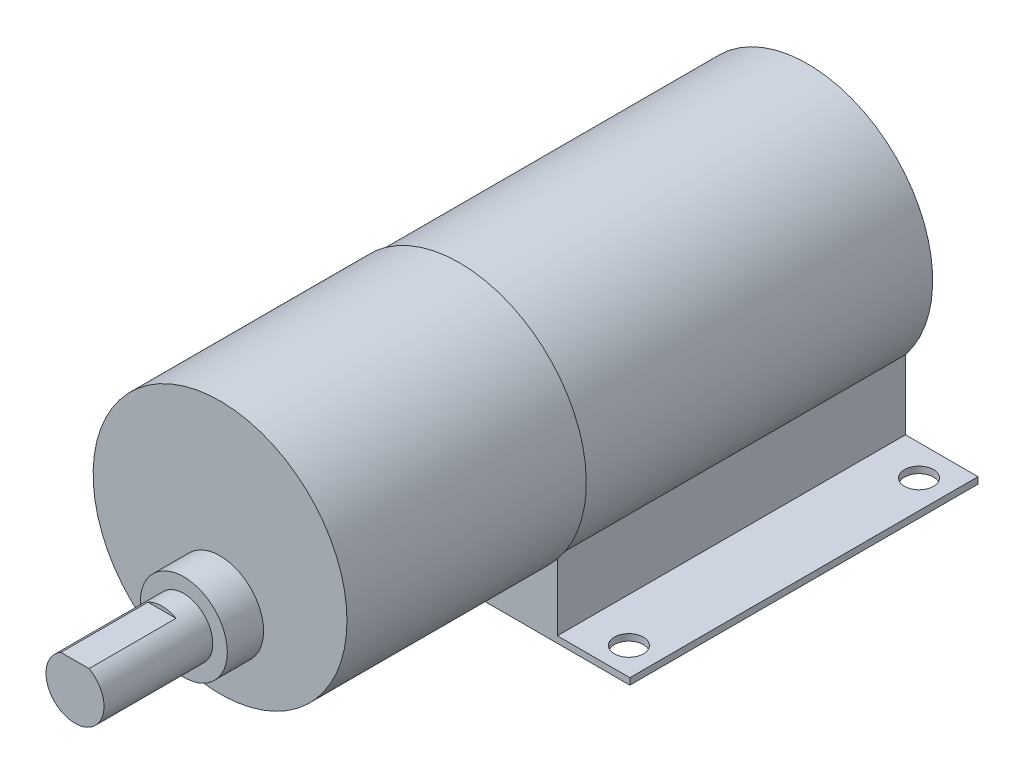
from build123d import *

# Parameters (mm, degrees)
EXTRUSION1_DEPTH    = 48
ESQUISSE2_R         = 2
EXTRUSION2_DEPTH    = 3
ESQUISSE3_R         = 17.5
EXTRUSION3_DEPTH    = 33
ESQUISSE4_R         = 6
EXTRUSION4_DEPTH    = 20
ESQUISSE5_OUTSIDE_W = 72.586
ESQUISSE5_OUTSIDE_H = 64.286
ESQUISSE5_OUTSIDE_R = 4
EXTRUSION6_DEPTH    = 15
ESQUISSE6_W         = 12.800429143
ESQUISSE6_H         = 4.483478886
EXTRUSION7_DEPTH    = 12
EXTRUSION8_START    = -21.2
EXTRUSION8_DEPTH    = 0.1


# Read off the part's stored shape, not the designer's step: Extrusion8
with BuildPart() as part:
    # Esquisse1 → Extrusion1 (new body)
    with BuildSketch(Plane.XY):
        with BuildLine():
            Line((-13.5, -10.738365797), (-13.5, -20.3))
            Line((-13.5, -20.3), (-23.5, -20.3))
            Line((-23.5, -20.3), (-23.5, -21.2))
            Line((-23.5, -21.2), (23.5, -21.2))
            Line((23.5, -21.2), (23.5, -20.3))
            Line((23.5, -20.3), (13.5, -20.3))
            Line((13.5, -20.3), (13.5, -10.738365797))
            ThreePointArc((13.5, -10.738365797), (0, 17.25), (-13.5, -10.738365797))
        make_face()
    extrude(amount=EXTRUSION1_DEPTH)

    # Esquisse2 → Extrusion2 (cut)
    with BuildSketch(Plane.XZ.offset(21.2)):
        with Locations((-19.411381194, 44.219649199)):
            Circle(ESQUISSE2_R)
        with Locations((19.588618806, 44.219649199)):
            Circle(ESQUISSE2_R)
        with Locations((19.588618806, 4.219649199)):
            Circle(ESQUISSE2_R)
        with Locations((-19.411381194, 4.219649199)):
            Circle(ESQUISSE2_R)
    extrude(amount=-EXTRUSION2_DEPTH, mode=Mode.SUBTRACT)

    # Esquisse3 → Extrusion3 (add)
    with BuildSketch(Plane.XY.offset(48)):
        with Locations(Location((0, 0, 0), (0, 0, 219.517652797))):
            Circle(ESQUISSE3_R)
    extrude(amount=EXTRUSION3_DEPTH)

    # Esquisse4 → Extrusion4 (add)
    with BuildSketch(Plane.XY.offset(81)):
        with Locations((0, -7)):
            Circle(ESQUISSE4_R)
    extrude(amount=EXTRUSION4_DEPTH)

    # Esquisse5 outside → Extrusion6 (cut)
    with BuildSketch(Plane.XY.offset(101)):
        with Locations((0, -1.85)):
            Rectangle(ESQUISSE5_OUTSIDE_W, ESQUISSE5_OUTSIDE_H)
        with Locations((0, -7)):
            Circle(ESQUISSE5_OUTSIDE_R, mode=Mode.SUBTRACT)
    extrude(amount=-EXTRUSION6_DEPTH, mode=Mode.SUBTRACT)

    # Esquisse6 → Extrusion7 (cut)
    with BuildSketch(Plane.XY.offset(101)):
        with Locations((-0.09625683, -1.258260557)):
            Rectangle(ESQUISSE6_W, ESQUISSE6_H)
    extrude(amount=-EXTRUSION7_DEPTH, mode=Mode.SUBTRACT)

    # Extrusion8 outline → Extrusion8 (cut)
    # profile 1 of 13: a face of its own
    with BuildSketch(Plane(origin=(0, 0, 0), x_dir=(1, 0, 0), z_dir=(0, 1, 0)).offset(EXTRUSION8_START)):
        with BuildLine():
            add(Edge.make_bspline(
                [(-13.374256386, -24.092045366), (-13.373133076, -24.134861912), (-13.370909114, -24.219631314), (-13.354588605, -24.344558375), (-13.327230049, -24.465255764), (-13.288498652, -24.58118124), (-13.238983461, -24.692936676), (-13.178622173, -24.800341507), (-13.106831541, -24.903329308), (-13.051629589, -24.967051388), (-13.023695488, -24.999296969)],
                knots=[0, 0, 0, 0, 0.128919132, 0.255237725, 0.378678596, 0.501087887, 0.622713679, 0.746240795, 0.871589047, 1, 1, 1, 1], degree=3))
            add(Edge.make_bspline(
                [(-13.023695488, -24.999296969), (-12.991246897, -25.033271908), (-12.927431034, -25.100089604), (-12.820082306, -25.185622128), (-12.707588485, -25.259538202), (-12.587863559, -25.319014417), (-12.462180701, -25.365852935), (-12.329961458, -25.39841845), (-12.191685943, -25.419671805), (-12.097126322, -25.421729983), (-12.049136194, -25.422774533)],
                knots=[0, 0, 0, 0, 0.128497521, 0.252712986, 0.374819133, 0.496436426, 0.617910557, 0.741287617, 0.868700401, 1, 1, 1, 1], degree=3))
            add(Edge.make_bspline(
                [(-12.049136194, -25.422774533), (-12.001144921, -25.421752642), (-11.907045763, -25.419748963), (-11.769237877, -25.398333997), (-11.637692741, -25.365586633), (-11.511906549, -25.320315071), (-11.393490254, -25.25963312), (-11.28071901, -25.187223829), (-11.173902001, -25.101441235), (-11.109878971, -25.035083167), (-11.077381386, -25.001400334)],
                knots=[0, 0, 0, 0, 0.131751427, 0.258332351, 0.382133976, 0.503804392, 0.624692987, 0.74687059, 0.871513504, 1, 1, 1, 1], degree=3))
            add(Edge.make_bspline(
                [(-11.077381386, -25.001400334), (-11.049399432, -24.969186348), (-10.993977052, -24.905381806), (-10.922911333, -24.801926193), (-10.861689773, -24.694786092), (-10.812626812, -24.582538766), (-10.773941788, -24.466164095), (-10.746476092, -24.345262083), (-10.730139157, -24.220099736), (-10.72793619, -24.135095898), (-10.726820488, -24.092045366)],
                knots=[0, 0, 0, 0, 0.12815728, 0.253834363, 0.376505623, 0.498533686, 0.621367729, 0.744564745, 0.870633798, 1, 1, 1, 1], degree=3))
            add(Edge.make_bspline(
                [(-10.726820488, -24.092045366), (-10.727801826, -24.048745308), (-10.729740994, -23.963182375), (-10.74808461, -23.837163009), (-10.776615696, -23.714968187), (-10.817447535, -23.597109493), (-10.869805644, -23.483226665), (-10.933696331, -23.373817116), (-11.009567948, -23.268664983), (-11.095571945, -23.168663145), (-11.190623821, -23.07649693), (-11.29373997, -22.99616866), (-11.402894003, -22.927347136), (-11.519537357, -22.87191072), (-11.642604844, -22.82820102), (-11.772361912, -22.797501003), (-11.908606982, -22.77893932), (-12.001634203, -22.776555746), (-12.049136194, -22.775338635)],
                knots=[0, 0, 0, 0, 0.062416026, 0.123336979, 0.18326514, 0.243172443, 0.302898354, 0.363773598, 0.425605305, 0.489659043, 0.553784577, 0.616221533, 0.677854471, 0.739516897, 0.802096536, 0.865865841, 0.931507795, 1, 1, 1, 1], degree=3))
            add(Edge.make_bspline(
                [(-12.049136194, -22.775338635), (-12.096870913, -22.776559831), (-12.190361773, -22.778951606), (-12.327087755, -22.797428889), (-12.457077374, -22.828186871), (-12.580305972, -22.872054364), (-12.697450819, -22.927348908), (-12.807237316, -22.995960597), (-12.910437232, -23.076520753), (-13.005509216, -23.16865669), (-13.091507821, -23.268666646), (-13.16738083, -23.373816684), (-13.231271156, -23.483226778), (-13.28362936, -23.597109463), (-13.324461173, -23.714968195), (-13.352992265, -23.837163007), (-13.37133588, -23.963182376), (-13.373275048, -24.048745309), (-13.374256386, -24.092045366)],
                knots=[0, 0, 0, 0, 0.068742262, 0.134635192, 0.198324187, 0.260825013, 0.322713588, 0.384554535, 0.446912858, 0.510957633, 0.574930701, 0.636684538, 0.697483115, 0.757133808, 0.816965664, 0.876818352, 0.93766258, 1, 1, 1, 1], degree=3))
        make_face()
        with BuildLine():
            add(Edge.make_bspline(
                [(-12.050538437, -23.089441199), (-12.005312068, -23.09075148), (-11.916036472, -23.093337936), (-11.785577295, -23.119056756), (-11.660663324, -23.159160417), (-11.542431936, -23.215082627), (-11.432865333, -23.286095042), (-11.333516211, -23.370531419), (-11.2477676, -23.46994527), (-11.174433995, -23.580502799), (-11.114887253, -23.699787151), (-11.071704051, -23.825577623), (-11.045706465, -23.956359665), (-11.042525636, -24.045187996), (-11.040923053, -24.089942001)],
                knots=[0, 0, 0, 0, 0.085605695, 0.168983264, 0.250907582, 0.333708096, 0.416004984, 0.497659568, 0.579893286, 0.663902321, 0.748466254, 0.831790886, 0.915251909, 1, 1, 1, 1], degree=3))
            add(Edge.make_bspline(
                [(-11.040923053, -24.089942001), (-11.041881323, -24.124579558), (-11.043767052, -24.192740984), (-11.058242016, -24.293003438), (-11.081397556, -24.389495034), (-11.113369173, -24.482347038), (-11.156023187, -24.570859542), (-11.20843998, -24.654889269), (-11.268671005, -24.736265815), (-11.338688126, -24.811619456), (-11.413991504, -24.881354492), (-11.494456542, -24.941983882), (-11.578241521, -24.993441477), (-11.665620104, -25.036127718), (-11.757072671, -25.068075058), (-11.8518798, -25.09145169), (-11.95007861, -25.105741886), (-12.016837653, -25.107689028), (-12.050538437, -25.108671969)],
                knots=[0, 0, 0, 0, 0.065184796, 0.128273727, 0.19027022, 0.251768314, 0.312768695, 0.374793279, 0.437969586, 0.5030474, 0.568125214, 0.630949749, 0.692369109, 0.752973168, 0.813641067, 0.874355209, 0.936572968, 1, 1, 1, 1], degree=3))
            add(Edge.make_bspline(
                [(-12.050538437, -25.108671969), (-12.084476049, -25.107707377), (-12.151475177, -25.105803094), (-12.250094762, -25.09131919), (-12.345034916, -25.068371686), (-12.43647576, -25.035767629), (-12.524108932, -24.99366873), (-12.608018335, -24.94196037), (-12.688450775, -24.881327414), (-12.763832838, -24.811864742), (-12.83301515, -24.735985748), (-12.893493127, -24.655137389), (-12.944918233, -24.570631042), (-12.987758392, -24.482378831), (-13.01966558, -24.389486417), (-13.042838603, -24.293005786), (-13.057308843, -24.19274037), (-13.059195222, -24.124579351), (-13.060153822, -24.089942001)],
                knots=[0, 0, 0, 0, 0.0638459, 0.126043628, 0.187165358, 0.24739929, 0.308380031, 0.369779617, 0.432583925, 0.497640786, 0.562401137, 0.625557103, 0.687332005, 0.748312746, 0.809791039, 0.871767572, 0.934836191, 1, 1, 1, 1], degree=3))
            add(Edge.make_bspline(
                [(-13.060153822, -24.089942001), (-13.058546998, -24.045189973), (-13.055357754, -23.956365568), (-13.029422517, -23.825554445), (-12.986036237, -23.699972593), (-12.927448958, -23.580356207), (-12.854042739, -23.469683929), (-12.767555672, -23.371012445), (-12.668915972, -23.285826633), (-12.559299472, -23.215145788), (-12.440945154, -23.158986032), (-12.315688833, -23.119187056), (-12.185048139, -23.093315364), (-12.095767408, -23.09074389), (-12.050538437, -23.089441199)],
                knots=[0, 0, 0, 0, 0.084732745, 0.168178654, 0.251488198, 0.335840671, 0.419834494, 0.502344876, 0.58364902, 0.665931005, 0.748716525, 0.831047336, 0.914409807, 1, 1, 1, 1], degree=3))
        make_face(mode=Mode.SUBTRACT)
    # profile 2 of 13: a face of its own
    with BuildSketch(Plane(origin=(0, 0, 0), x_dir=(1, 0, 0), z_dir=(0, 1, 0)).offset(EXTRUSION8_START)):
        with BuildLine():
            add(Edge.make_bspline(
                [(-8.572974335, -24.092045366), (-8.571851024, -24.134861912), (-8.569627063, -24.219631314), (-8.553306554, -24.344558375), (-8.525947997, -24.465255764), (-8.487216601, -24.58118124), (-8.43770141, -24.692936676), (-8.377340122, -24.800341507), (-8.305549489, -24.903329308), (-8.250347538, -24.967051388), (-8.222413437, -24.999296969)],
                knots=[0, 0, 0, 0, 0.128919132, 0.255237725, 0.378678596, 0.501087887, 0.622713679, 0.746240795, 0.871589047, 1, 1, 1, 1], degree=3))
            add(Edge.make_bspline(
                [(-8.222413437, -24.999296969), (-8.189964846, -25.033271908), (-8.126148982, -25.100089604), (-8.018800255, -25.185622128), (-7.906306433, -25.259538202), (-7.786581507, -25.319014417), (-7.660898649, -25.365852935), (-7.528679407, -25.39841845), (-7.390403891, -25.419671805), (-7.29584427, -25.421729983), (-7.247854142, -25.422774533)],
                knots=[0, 0, 0, 0, 0.128497521, 0.252712986, 0.374819133, 0.496436426, 0.617910557, 0.741287617, 0.868700401, 1, 1, 1, 1], degree=3))
            add(Edge.make_bspline(
                [(-7.247854142, -25.422774533), (-7.199862869, -25.421752642), (-7.105763712, -25.419748963), (-6.967955826, -25.398333997), (-6.83641069, -25.365586633), (-6.710624498, -25.320315071), (-6.592208202, -25.25963312), (-6.479436958, -25.187223829), (-6.372619949, -25.101441235), (-6.30859692, -25.035083167), (-6.276099335, -25.001400334)],
                knots=[0, 0, 0, 0, 0.131751427, 0.258332351, 0.382133976, 0.503804392, 0.624692987, 0.74687059, 0.871513504, 1, 1, 1, 1], degree=3))
            add(Edge.make_bspline(
                [(-6.276099335, -25.001400334), (-6.248117381, -24.969186348), (-6.192695, -24.905381806), (-6.121629282, -24.801926193), (-6.060407721, -24.694786092), (-6.01134476, -24.582538766), (-5.972659737, -24.466164095), (-5.94519404, -24.345262083), (-5.928857105, -24.220099736), (-5.926654139, -24.135095898), (-5.925538437, -24.092045366)],
                knots=[0, 0, 0, 0, 0.12815728, 0.253834363, 0.376505623, 0.498533686, 0.621367729, 0.744564745, 0.870633798, 1, 1, 1, 1], degree=3))
            add(Edge.make_bspline(
                [(-5.925538437, -24.092045366), (-5.926519774, -24.048745308), (-5.928458943, -23.963182375), (-5.946802559, -23.837163009), (-5.975333645, -23.714968187), (-6.016165483, -23.597109493), (-6.068523593, -23.483226665), (-6.13241428, -23.373817116), (-6.208285897, -23.268664983), (-6.294289894, -23.168663145), (-6.38934177, -23.07649693), (-6.492457918, -22.99616866), (-6.601611952, -22.927347136), (-6.718255305, -22.87191072), (-6.841322792, -22.82820102), (-6.97107986, -22.797501003), (-7.107324931, -22.77893932), (-7.200352152, -22.776555746), (-7.247854142, -22.775338635)],
                knots=[0, 0, 0, 0, 0.062416026, 0.123336979, 0.18326514, 0.243172443, 0.302898354, 0.363773598, 0.425605305, 0.489659043, 0.553784577, 0.616221533, 0.677854471, 0.739516897, 0.802096536, 0.865865841, 0.931507795, 1, 1, 1, 1], degree=3))
            add(Edge.make_bspline(
                [(-7.247854142, -22.775338635), (-7.295588862, -22.776559831), (-7.389079722, -22.778951606), (-7.525805703, -22.797428889), (-7.655795322, -22.828186871), (-7.779023921, -22.872054364), (-7.896168768, -22.927348908), (-8.005955265, -22.995960597), (-8.10915518, -23.076520753), (-8.204227165, -23.16865669), (-8.29022577, -23.268666646), (-8.366098778, -23.373816684), (-8.429989105, -23.483226778), (-8.482347308, -23.597109463), (-8.523179121, -23.714968195), (-8.551710214, -23.837163007), (-8.570053829, -23.963182376), (-8.571992997, -24.048745309), (-8.572974335, -24.092045366)],
                knots=[0, 0, 0, 0, 0.068742262, 0.134635192, 0.198324187, 0.260825013, 0.322713588, 0.384554535, 0.446912858, 0.510957633, 0.574930701, 0.636684538, 0.697483115, 0.757133808, 0.816965664, 0.876818352, 0.93766258, 1, 1, 1, 1], degree=3))
        make_face()
        with BuildLine():
            add(Edge.make_bspline(
                [(-7.249256386, -23.089441199), (-7.204030017, -23.09075148), (-7.114754421, -23.093337936), (-6.984295244, -23.119056756), (-6.859381272, -23.159160417), (-6.741149885, -23.215082627), (-6.631583281, -23.286095042), (-6.53223416, -23.370531419), (-6.446485549, -23.46994527), (-6.373151944, -23.580502799), (-6.313605201, -23.699787151), (-6.270421999, -23.825577623), (-6.244424414, -23.956359665), (-6.241243585, -24.045187996), (-6.239641001, -24.089942001)],
                knots=[0, 0, 0, 0, 0.085605695, 0.168983264, 0.250907582, 0.333708096, 0.416004984, 0.497659568, 0.579893286, 0.663902321, 0.748466254, 0.831790886, 0.915251909, 1, 1, 1, 1], degree=3))
            add(Edge.make_bspline(
                [(-6.239641001, -24.089942001), (-6.240599271, -24.124579558), (-6.242485, -24.192740984), (-6.256959965, -24.293003438), (-6.280115504, -24.389495034), (-6.312087122, -24.482347038), (-6.354741136, -24.570859542), (-6.407157929, -24.654889269), (-6.467388954, -24.736265815), (-6.537406075, -24.811619456), (-6.612709453, -24.881354492), (-6.693174491, -24.941983882), (-6.77695947, -24.993441477), (-6.864338052, -25.036127718), (-6.95579062, -25.068075058), (-7.050597749, -25.09145169), (-7.148796559, -25.105741886), (-7.215555602, -25.107689028), (-7.249256386, -25.108671969)],
                knots=[0, 0, 0, 0, 0.065184796, 0.128273727, 0.19027022, 0.251768314, 0.312768695, 0.374793279, 0.437969586, 0.5030474, 0.568125214, 0.630949749, 0.692369109, 0.752973168, 0.813641067, 0.874355209, 0.936572968, 1, 1, 1, 1], degree=3))
            add(Edge.make_bspline(
                [(-7.249256386, -25.108671969), (-7.283193997, -25.107707377), (-7.350193126, -25.105803094), (-7.448812711, -25.09131919), (-7.543752865, -25.068371686), (-7.635193709, -25.035767629), (-7.722826881, -24.99366873), (-7.806736283, -24.94196037), (-7.887168723, -24.881327414), (-7.962550787, -24.811864742), (-8.031733099, -24.735985748), (-8.092211076, -24.655137389), (-8.143636182, -24.570631042), (-8.186476341, -24.482378831), (-8.218383529, -24.389486417), (-8.241556551, -24.293005786), (-8.256026792, -24.19274037), (-8.25791317, -24.124579351), (-8.258871771, -24.089942001)],
                knots=[0, 0, 0, 0, 0.0638459, 0.126043628, 0.187165358, 0.24739929, 0.308380031, 0.369779617, 0.432583925, 0.497640786, 0.562401137, 0.625557103, 0.687332005, 0.748312746, 0.809791039, 0.871767572, 0.934836191, 1, 1, 1, 1], degree=3))
            add(Edge.make_bspline(
                [(-8.258871771, -24.089942001), (-8.257264947, -24.045189973), (-8.254075702, -23.956365568), (-8.228140466, -23.825554445), (-8.184754186, -23.699972593), (-8.126166906, -23.580356207), (-8.052760688, -23.469683929), (-7.966273621, -23.371012445), (-7.867633921, -23.285826633), (-7.75801742, -23.215145788), (-7.639663103, -23.158986032), (-7.514406781, -23.119187056), (-7.383766087, -23.093315364), (-7.294485356, -23.09074389), (-7.249256386, -23.089441199)],
                knots=[0, 0, 0, 0, 0.084732745, 0.168178654, 0.251488198, 0.335840671, 0.419834494, 0.502344876, 0.58364902, 0.665931005, 0.748716525, 0.831047336, 0.914409807, 1, 1, 1, 1], degree=3))
        make_face(mode=Mode.SUBTRACT)
    # profile 3 of 13: a face of its own
    with BuildSketch(Plane(origin=(0, 0, 0), x_dir=(1, 0, 0), z_dir=(0, 1, 0)).offset(EXTRUSION8_START)):
        with BuildLine():
            Line((-5.072974335, -25.377902738), (-5.072974335, -25.001400334))
            add(Edge.make_bspline(
                [(-5.072974335, -25.001400334), (-5.049785576, -25.036456162), (-5.005437255, -25.103500162), (-4.931724326, -25.192169463), (-4.856220994, -25.265584509), (-4.778565807, -25.324088028), (-4.698187707, -25.367901147), (-4.616850755, -25.399994182), (-4.533275286, -25.418971497), (-4.477113361, -25.421505156), (-4.448975937, -25.422774533)],
                knots=[0, 0, 0, 0, 0.160059412, 0.306112383, 0.438366514, 0.560541455, 0.675317225, 0.786113634, 0.892841788, 1, 1, 1, 1], degree=3))
            add(Edge.make_bspline(
                [(-4.448975937, -25.422774533), (-4.427149611, -25.421584006), (-4.382240525, -25.41913442), (-4.314257936, -25.401923596), (-4.244214484, -25.374445573), (-4.199072097, -25.34860535), (-4.175538437, -25.335134308)],
                knots=[0, 0, 0, 0, 0.225277548, 0.463523195, 0.720323555, 1, 1, 1, 1], degree=3))
            Line((-4.175538437, -25.335134308), (-4.348014399, -25.063099052))
            add(Edge.make_bspline(
                [(-4.348014399, -25.063099052), (-4.36312342, -25.069839318), (-4.391803234, -25.082633633), (-4.433757801, -25.097775644), (-4.472439137, -25.106691559), (-4.497082696, -25.108042277), (-4.50857129, -25.108671969)],
                knots=[0, 0, 0, 0, 0.295138801, 0.560229945, 0.794983357, 1, 1, 1, 1], degree=3))
            add(Edge.make_bspline(
                [(-4.50857129, -25.108671969), (-4.533777023, -25.106991931), (-4.585189413, -25.103565142), (-4.660673913, -25.076626334), (-4.733921118, -25.033101094), (-4.79209278, -24.984829982), (-4.837135033, -24.938282185), (-4.869275259, -24.897633782), (-4.898758006, -24.852055151), (-4.926928226, -24.802325467), (-4.95259452, -24.747595621), (-4.97654919, -24.688412407), (-4.998208053, -24.624707279), (-5.010558297, -24.580324758), (-5.016884591, -24.557590238)],
                knots=[0, 0, 0, 0, 0.093806529, 0.191338128, 0.295190617, 0.410312337, 0.471930251, 0.536425159, 0.603118728, 0.674117672, 0.749332023, 0.828283384, 0.912039809, 1, 1, 1, 1], degree=3))
            add(Edge.make_bspline(
                [(-5.016884591, -24.557590238), (-5.021616984, -24.537313064), (-5.032098876, -24.492400666), (-5.042290414, -24.417052141), (-5.052359932, -24.328028482), (-5.05945655, -24.225081889), (-5.066034592, -24.108469445), (-5.069744675, -23.9780135), (-5.072847815, -23.833580149), (-5.072930882, -23.732605795), (-5.072974335, -23.679785751)],
                knots=[0, 0, 0, 0, 0.070854869, 0.15693815, 0.258600395, 0.37589093, 0.508166168, 0.656237809, 0.82017677, 1, 1, 1, 1], degree=3))
            Line((-5.072974335, -23.679785751), (-5.072974335, -22.82021043))
            Line((-5.072974335, -22.82021043), (-5.387076899, -22.82021043))
            Line((-5.387076899, -22.82021043), (-5.387076899, -25.377902738))
            Line((-5.387076899, -25.377902738), (-5.072974335, -25.377902738))
        make_face()
    # profile 4 of 13: a face of its own
    with BuildSketch(Plane(origin=(0, 0, 0), x_dir=(1, 0, 0), z_dir=(0, 1, 0)).offset(EXTRUSION8_START)):
        with BuildLine():
            add(Edge.make_bspline(
                [(-3.637076899, -24.031748892), (-3.635537292, -23.998048427), (-3.632509718, -23.931777824), (-3.618394575, -23.834807041), (-3.596145801, -23.742433698), (-3.564876739, -23.655350656), (-3.527009894, -23.572420529), (-3.480624177, -23.494258492), (-3.425284623, -23.421220562), (-3.363558923, -23.352653424), (-3.294851828, -23.291592663), (-3.222569081, -23.236940887), (-3.145675516, -23.19113529), (-3.064777432, -23.1539554), (-2.980005647, -23.124849084), (-2.891333452, -23.104981264), (-2.798935336, -23.091674157), (-2.735949602, -23.090194492), (-2.70388379, -23.089441199)],
                knots=[0, 0, 0, 0, 0.068384615, 0.134475588, 0.198391058, 0.260753477, 0.321829223, 0.383037238, 0.444653123, 0.507398011, 0.569825238, 0.630777641, 0.690928687, 0.750945133, 0.811049477, 0.872330853, 0.935004094, 1, 1, 1, 1], degree=3))
            add(Edge.make_bspline(
                [(-2.70388379, -23.089441199), (-2.672532642, -23.090049256), (-2.610325951, -23.091255757), (-2.517685094, -23.102987668), (-2.426545566, -23.121957944), (-2.337284583, -23.147847934), (-2.251713737, -23.179424786), (-2.172468187, -23.217527643), (-2.099587972, -23.25967739), (-2.031471005, -23.307887065), (-1.965400012, -23.366895252), (-1.899857525, -23.440530973), (-1.829580872, -23.527618501), (-1.785591279, -23.593164167), (-1.762277219, -23.627902738)],
                knots=[0, 0, 0, 0, 0.082592263, 0.163878894, 0.24565874, 0.327725695, 0.408609961, 0.485749086, 0.559169056, 0.630268476, 0.705306028, 0.792064966, 0.889796437, 1, 1, 1, 1], degree=3))
            Line((-1.762277219, -23.627902738), (-1.483230745, -23.481368283))
            add(Edge.make_bspline(
                [(-1.483230745, -23.481368283), (-1.50546734, -23.441924951), (-1.548730949, -23.365183849), (-1.623131696, -23.259751988), (-1.701123769, -23.164904272), (-1.786227737, -23.083174618), (-1.875897416, -23.011923233), (-1.970630071, -22.949585408), (-2.070918889, -22.896466888), (-2.176768613, -22.85171436), (-2.289068164, -22.817304866), (-2.408089681, -22.793000645), (-2.534061176, -22.777977376), (-2.620407356, -22.776232236), (-2.664620969, -22.775338635)],
                knots=[0, 0, 0, 0, 0.093369857, 0.181660766, 0.265874227, 0.346354784, 0.424599862, 0.501903184, 0.579992091, 0.658443431, 0.738672236, 0.821894148, 0.908800792, 1, 1, 1, 1], degree=3))
            add(Edge.make_bspline(
                [(-2.664620969, -22.775338635), (-2.713762947, -22.776485811), (-2.809624708, -22.778723617), (-2.949164456, -22.798016082), (-3.080543874, -22.82948844), (-3.203755577, -22.873453982), (-3.31849783, -22.930881306), (-3.424998685, -23.000840788), (-3.523818211, -23.082973043), (-3.61184242, -23.177989486), (-3.691086302, -23.279671443), (-3.761012122, -23.385627328), (-3.819469553, -23.495590552), (-3.867022164, -23.608861076), (-3.905427029, -23.72472497), (-3.932193732, -23.844236437), (-3.94762348, -23.967072022), (-3.949987926, -24.050169357), (-3.951179463, -24.092045366)],
                knots=[0, 0, 0, 0, 0.071578658, 0.139629225, 0.204796697, 0.268134963, 0.329813747, 0.391301398, 0.453433515, 0.51655169, 0.579631271, 0.641118921, 0.701294047, 0.760810336, 0.819931722, 0.878919575, 0.938982822, 1, 1, 1, 1], degree=3))
            add(Edge.make_bspline(
                [(-3.951179463, -24.092045366), (-3.950120321, -24.131340196), (-3.948021243, -24.209217361), (-3.934790456, -24.324482906), (-3.911342163, -24.436511358), (-3.879165839, -24.545395806), (-3.837614593, -24.65095394), (-3.786782373, -24.753250004), (-3.726589996, -24.852175144), (-3.680117322, -24.914578277), (-3.656708309, -24.946011712)],
                knots=[0, 0, 0, 0, 0.128044808, 0.2537679, 0.377428427, 0.500550841, 0.623295883, 0.746578332, 0.872347541, 1, 1, 1, 1], degree=3))
            add(Edge.make_bspline(
                [(-3.656708309, -24.946011712), (-3.625000626, -24.983880582), (-3.56258968, -25.058418733), (-3.457033324, -25.156357058), (-3.342733128, -25.238400834), (-3.221121502, -25.30640797), (-3.090785028, -25.358081617), (-2.953475737, -25.396589199), (-2.80763015, -25.41816721), (-2.70792493, -25.421215044), (-2.656908629, -25.422774533)],
                knots=[0, 0, 0, 0, 0.128835254, 0.253589335, 0.374643257, 0.495340042, 0.616324775, 0.739759335, 0.86684232, 1, 1, 1, 1], degree=3))
            add(Edge.make_bspline(
                [(-2.656908629, -25.422774533), (-2.604461024, -25.421420484), (-2.501570778, -25.418764149), (-2.351538657, -25.394137815), (-2.209577941, -25.355085261), (-2.075745436, -25.29993147), (-1.950027576, -25.228771918), (-1.833241526, -25.140630077), (-1.723390013, -25.03821199), (-1.659481435, -24.95944878), (-1.626960713, -24.919369084)],
                knots=[0, 0, 0, 0, 0.132040234, 0.259032841, 0.381879824, 0.502258444, 0.62275219, 0.744742632, 0.870108927, 1, 1, 1, 1], degree=3))
            add(Edge.make_bspline(
                [(-1.626960713, -24.919369084), (-1.604833775, -24.889165503), (-1.560727181, -24.828959384), (-1.505480081, -24.730788227), (-1.457522686, -24.628077632), (-1.419189725, -24.519167335), (-1.388150224, -24.405347755), (-1.365693405, -24.28580521), (-1.352523787, -24.160575299), (-1.34993509, -24.075248744), (-1.34861536, -24.031748892)],
                knots=[0, 0, 0, 0, 0.11852184, 0.236254763, 0.356174434, 0.477249655, 0.601539871, 0.729618382, 0.862158266, 1, 1, 1, 1], degree=3))
            Line((-1.34861536, -24.031748892), (-3.637076899, -24.031748892))
        make_face()
        with BuildLine():
            add(Edge.make_bspline(
                [(-2.640782828, -25.108671969), (-2.672132267, -25.108060297), (-2.734103516, -25.106851151), (-2.825404584, -25.095381022), (-2.913084283, -25.076421177), (-2.99778957, -25.05045622), (-3.078410439, -25.015847618), (-3.156605207, -24.975264391), (-3.230385603, -24.925722807), (-3.276526899, -24.887963952), (-3.299837315, -24.868888315)],
                knots=[0, 0, 0, 0, 0.131091976, 0.259141276, 0.384161763, 0.505991952, 0.629098089, 0.750669123, 0.874038938, 1, 1, 1, 1], degree=3))
            add(Edge.make_bspline(
                [(-3.299837315, -24.868888315), (-3.316530597, -24.853793999), (-3.350313732, -24.823246783), (-3.395454253, -24.770617577), (-3.438674726, -24.713866014), (-3.478008379, -24.65082089), (-3.514085965, -24.582200111), (-3.547845942, -24.508582476), (-3.578232354, -24.429409345), (-3.595328464, -24.374236906), (-3.604124174, -24.345851456)],
                knots=[0, 0, 0, 0, 0.109983845, 0.222580497, 0.338499871, 0.458708565, 0.585535346, 0.717517743, 0.85466682, 1, 1, 1, 1], degree=3))
            Line((-3.604124174, -24.345851456), (-1.662717924, -24.345851456))
            add(Edge.make_bspline(
                [(-1.662717924, -24.345851456), (-1.674214549, -24.387514329), (-1.69634185, -24.46770195), (-1.742578215, -24.578742841), (-1.794649756, -24.677430742), (-1.856271487, -24.763010375), (-1.926090213, -24.839013888), (-2.006735395, -24.905432473), (-2.097171289, -24.964849924), (-2.196930429, -25.015002423), (-2.302572214, -25.057692282), (-2.413178406, -25.086317398), (-2.526036194, -25.10592694), (-2.602370481, -25.107753048), (-2.640782828, -25.108671969)],
                knots=[0, 0, 0, 0, 0.096240125, 0.185231261, 0.267500523, 0.344400382, 0.419594869, 0.496890627, 0.576637919, 0.660267852, 0.745386615, 0.830040327, 0.914474212, 1, 1, 1, 1], degree=3))
        make_face(mode=Mode.SUBTRACT)
    # profile 5 of 13: a face of its own
    with BuildSketch(Plane(origin=(0, 0, 0), x_dir=(1, 0, 0), z_dir=(0, 1, 0)).offset(EXTRUSION8_START)):
        with BuildLine():
            Line((1.568051306, -22.82021043), (1.568051306, -23.262618283))
            add(Edge.make_bspline(
                [(1.568051306, -23.262618283), (1.532632516, -23.222578689), (1.463512301, -23.144440918), (1.348071183, -23.042358745), (1.225703005, -22.957980424), (1.097001683, -22.889830508), (0.96208344, -22.838638452), (0.821247353, -22.802252292), (0.674435972, -22.778858457), (0.574183617, -22.776522435), (0.523379832, -22.775338635)],
                knots=[0, 0, 0, 0, 0.134298379, 0.262084975, 0.386269912, 0.507164597, 0.627300236, 0.748144942, 0.872370177, 1, 1, 1, 1], degree=3))
            add(Edge.make_bspline(
                [(0.523379832, -22.775338635), (0.478211878, -22.776565008), (0.389138673, -22.778983468), (0.258109596, -22.797745772), (0.132017347, -22.827876393), (0.010742774, -22.869777283), (-0.104929371, -22.925358104), (-0.215989468, -22.991899352), (-0.32186216, -23.071140182), (-0.420933699, -23.161728211), (-0.512165699, -23.260123198), (-0.592226972, -23.365068745), (-0.658980052, -23.476111049), (-0.714800133, -23.591844203), (-0.757796477, -23.713159122), (-0.787770111, -23.83963629), (-0.806510558, -23.971126164), (-0.808928019, -24.060665687), (-0.810153822, -24.106067802)],
                knots=[0, 0, 0, 0, 0.064619991, 0.127433484, 0.189004127, 0.249930071, 0.310668454, 0.372328961, 0.43493911, 0.499575544, 0.564191208, 0.626735217, 0.688109334, 0.749293607, 0.810330528, 0.87190117, 0.935045915, 1, 1, 1, 1], degree=3))
            add(Edge.make_bspline(
                [(-0.810153822, -24.106067802), (-0.80890085, -24.150531505), (-0.806423794, -24.238433849), (-0.787970574, -24.367712547), (-0.756939565, -24.492230808), (-0.713391717, -24.611587751), (-0.657549762, -24.725927801), (-0.589621675, -24.835331826), (-0.509602551, -24.940101223), (-0.417350144, -25.03777245), (-0.317415374, -25.127993064), (-0.210506643, -25.20640211), (-0.099283361, -25.274118959), (0.017979649, -25.327772435), (0.139546754, -25.37118154), (0.2665002, -25.401214508), (0.398311778, -25.418911829), (0.487802271, -25.421474593), (0.533195537, -25.422774533)],
                knots=[0, 0, 0, 0, 0.063774532, 0.12607881, 0.186904093, 0.247573935, 0.308003356, 0.369131898, 0.432033228, 0.496790794, 0.561610823, 0.624913866, 0.686726349, 0.748078833, 0.809582291, 0.871630743, 0.934885821, 1, 1, 1, 1], degree=3))
            add(Edge.make_bspline(
                [(0.533195537, -25.422774533), (0.585412345, -25.421207437), (0.687908136, -25.418131401), (0.837806657, -25.392425034), (0.979594268, -25.349262156), (1.114087255, -25.290170875), (1.240483815, -25.213370124), (1.359710456, -25.120618676), (1.469693779, -25.00929153), (1.534765601, -24.925679956), (1.568051306, -24.882910751)],
                knots=[0, 0, 0, 0, 0.128884001, 0.252984972, 0.374210437, 0.494101513, 0.614752763, 0.73851107, 0.866242514, 1, 1, 1, 1], degree=3))
            Line((1.568051306, -24.882910751), (1.568051306, -26.40995402))
            Line((1.568051306, -26.40995402), (1.882153871, -26.40995402))
            Line((1.882153871, -26.40995402), (1.882153871, -22.82021043))
            Line((1.882153871, -22.82021043), (1.568051306, -22.82021043))
        make_face()
        with BuildLine():
            add(Edge.make_bspline(
                [(0.534597781, -23.089441199), (0.580044284, -23.091101163), (0.67043287, -23.094402667), (0.803871578, -23.119683932), (0.933366541, -23.161452731), (1.057153769, -23.219351857), (1.1724699, -23.291109213), (1.275967778, -23.375116304), (1.363483746, -23.472819488), (1.437676356, -23.580195941), (1.495851773, -23.697907938), (1.538227832, -23.823242129), (1.563281737, -23.956202877), (1.566439467, -24.047066804), (1.568051306, -24.09344761)],
                knots=[0, 0, 0, 0, 0.084802388, 0.16866354, 0.252551924, 0.338239689, 0.423102661, 0.505556051, 0.586175656, 0.66713572, 0.74849918, 0.830452399, 0.913455706, 1, 1, 1, 1], degree=3))
            add(Edge.make_bspline(
                [(1.568051306, -24.09344761), (1.56709165, -24.12878544), (1.565202743, -24.198341473), (1.550772173, -24.300468991), (1.527817247, -24.398202717), (1.495471077, -24.491645406), (1.452979792, -24.580280422), (1.401732026, -24.664744182), (1.340826577, -24.744597393), (1.271243881, -24.818740464), (1.195078678, -24.886366926), (1.114484137, -24.946731167), (1.02850539, -24.99631994), (0.938588353, -25.037361211), (0.844577019, -25.070020361), (0.745706399, -25.091808055), (0.643027412, -25.106768376), (0.572981357, -25.108030757), (0.537402268, -25.108671969)],
                knots=[0, 0, 0, 0, 0.0656338, 0.129188088, 0.191218683, 0.251912818, 0.312507474, 0.373494434, 0.4351516, 0.498741474, 0.562095217, 0.624186567, 0.685475718, 0.746096815, 0.807611636, 0.869966581, 0.933951019, 1, 1, 1, 1], degree=3))
            add(Edge.make_bspline(
                [(0.537402268, -25.108671969), (0.49148793, -25.107038331), (0.40086033, -25.10381379), (0.267816328, -25.078640295), (0.140502914, -25.0367557), (0.01955684, -24.979473799), (-0.093111377, -24.907445062), (-0.193805048, -24.820323679), (-0.283347749, -24.720486665), (-0.358656013, -24.608384555), (-0.42004651, -24.488206464), (-0.463213542, -24.362582025), (-0.49168279, -24.233777048), (-0.49459131, -24.146414362), (-0.496051258, -24.102562193)],
                knots=[0, 0, 0, 0, 0.085920517, 0.169593435, 0.252475515, 0.336244477, 0.419504521, 0.502035907, 0.584774648, 0.669846475, 0.754184866, 0.836658238, 0.918009726, 1, 1, 1, 1], degree=3))
            add(Edge.make_bspline(
                [(-0.496051258, -24.102562193), (-0.494186364, -24.058972086), (-0.490463888, -23.97196273), (-0.463713193, -23.842982153), (-0.41883332, -23.717328111), (-0.357591257, -23.596067118), (-0.280904632, -23.483483017), (-0.19201598, -23.381742895), (-0.090065698, -23.294253306), (0.022861809, -23.221015733), (0.143469779, -23.161853212), (0.270303711, -23.120687572), (0.400979349, -23.094109792), (0.489831683, -23.091005315), (0.534597781, -23.089441199)],
                knots=[0, 0, 0, 0, 0.081589349, 0.162858895, 0.245483689, 0.330807139, 0.416493374, 0.499893203, 0.583048156, 0.667157852, 0.751311929, 0.833784789, 0.916256489, 1, 1, 1, 1], degree=3))
        make_face(mode=Mode.SUBTRACT)
    # profile 6 of 13: a face of its own
    with BuildSketch(Plane(origin=(0, 0, 0), x_dir=(1, 0, 0), z_dir=(0, 1, 0)).offset(EXTRUSION8_START)):
        with BuildLine():
            Line((2.869333358, -25.377902738), (2.869333358, -24.191604661))
            add(Edge.make_bspline(
                [(2.869333358, -24.191604661), (2.869475263, -24.156781912), (2.86974672, -24.090167624), (2.871587661, -23.994312437), (2.875917755, -23.906895724), (2.881331579, -23.827866988), (2.888293715, -23.757239596), (2.896577076, -23.695260239), (2.905835497, -23.641226055), (2.914898211, -23.608682699), (2.919113005, -23.59354777)],
                knots=[0, 0, 0, 0, 0.173616576, 0.332120377, 0.477936277, 0.60993181, 0.727031521, 0.831671423, 0.921715476, 1, 1, 1, 1], degree=3))
            add(Edge.make_bspline(
                [(2.919113005, -23.59354777), (2.92587446, -23.574524899), (2.939256801, -23.536874638), (2.963530285, -23.482485633), (2.993558621, -23.43211035), (3.026418449, -23.383806277), (3.064317857, -23.339004291), (3.106777328, -23.297780047), (3.152375565, -23.258575956), (3.220130588, -23.212191164), (3.312789854, -23.162475834), (3.43444261, -23.119580015), (3.566346836, -23.093944195), (3.657511555, -23.09096994), (3.704369415, -23.089441199)],
                knots=[0, 0, 0, 0, 0.060486719, 0.119715933, 0.178086164, 0.235971321, 0.294609768, 0.353536018, 0.413161309, 0.474545309, 0.599233517, 0.727029212, 0.859695426, 1, 1, 1, 1], degree=3))
            add(Edge.make_bspline(
                [(3.704369415, -23.089441199), (3.751222923, -23.091002448), (3.841875791, -23.094023175), (3.972330761, -23.118806714), (4.091582175, -23.160212403), (4.198433126, -23.218019815), (4.292398967, -23.288761877), (4.370703385, -23.371770686), (4.43531064, -23.464420073), (4.463520061, -23.533544352), (4.477706755, -23.568307385)],
                knots=[0, 0, 0, 0, 0.144632416, 0.279836964, 0.408371312, 0.53304287, 0.653596301, 0.770015738, 0.884339472, 1, 1, 1, 1], degree=3))
            add(Edge.make_bspline(
                [(4.477706755, -23.568307385), (4.481900985, -23.582273684), (4.491173404, -23.613149759), (4.501135755, -23.665529508), (4.510110217, -23.727994112), (4.517773393, -23.800952321), (4.523238555, -23.884213473), (4.526184582, -23.97775155), (4.529512857, -24.08127291), (4.529563373, -24.153740669), (4.529589768, -24.191604661)],
                knots=[0, 0, 0, 0, 0.069692756, 0.154073662, 0.254591451, 0.371465414, 0.504754566, 0.653494295, 0.818952741, 1, 1, 1, 1], degree=3))
            Line((4.529589768, -24.191604661), (4.529589768, -25.377902738))
            Line((4.529589768, -25.377902738), (4.843692332, -25.377902738))
            Line((4.843692332, -25.377902738), (4.843692332, -24.13271043))
            add(Edge.make_bspline(
                [(4.843692332, -24.13271043), (4.843250637, -24.090403259), (4.842393689, -24.008321559), (4.836886345, -23.889037447), (4.827436733, -23.777875202), (4.813094048, -23.674775983), (4.796228373, -23.579818501), (4.7744721, -23.492881055), (4.748493862, -23.414231501), (4.719188347, -23.342489724), (4.68456648, -23.27744283), (4.647739459, -23.215707013), (4.605214688, -23.158814078), (4.560444453, -23.103931941), (4.510642797, -23.053790413), (4.456742938, -23.007238938), (4.399503519, -22.963565906), (4.337654321, -22.924474626), (4.272098258, -22.889257981), (4.202754401, -22.858041903), (4.128773402, -22.833339326), (4.051109766, -22.81202866), (3.969382986, -22.795314191), (3.883671853, -22.783527624), (3.794005237, -22.776302293), (3.732895777, -22.775665248), (3.701564928, -22.775338635)],
                knots=[0, 0, 0, 0, 0.062210033, 0.120695973, 0.175548464, 0.226190613, 0.273710731, 0.317302072, 0.357837298, 0.395427838, 0.431088527, 0.466097473, 0.50101522, 0.535423614, 0.570173538, 0.60476507, 0.640093035, 0.675938701, 0.71222479, 0.749455452, 0.787601117, 0.826783774, 0.86782857, 0.910159512, 0.953938739, 1, 1, 1, 1], degree=3))
            add(Edge.make_bspline(
                [(3.701564928, -22.775338635), (3.670468414, -22.775678342), (3.609360869, -22.776345899), (3.519689625, -22.783487706), (3.433741018, -22.795295877), (3.35182062, -22.812151094), (3.273846223, -22.833190164), (3.199501983, -22.8581937), (3.12965842, -22.889274181), (3.063476416, -22.924251739), (3.001474028, -22.963817014), (2.943365449, -23.007185054), (2.889228597, -23.054291117), (2.839051529, -23.104938474), (2.793538552, -23.159755411), (2.752122511, -23.218300971), (2.714165805, -23.279995059), (2.679813015, -23.346058222), (2.65030126, -23.418630232), (2.624246014, -23.498927329), (2.602935375, -23.587829846), (2.585592907, -23.685261774), (2.571641466, -23.790756816), (2.561955324, -23.904925231), (2.556539493, -24.027488923), (2.555676432, -24.112138813), (2.555230794, -24.155847449)],
                knots=[0, 0, 0, 0, 0.045151679, 0.088727252, 0.130534111, 0.171070746, 0.21009584, 0.247769237, 0.284849364, 0.320985502, 0.356387376, 0.391549279, 0.426191361, 0.460511059, 0.49497144, 0.529533625, 0.564575748, 0.600096189, 0.637534945, 0.678213416, 0.722582743, 0.770182304, 0.821879282, 0.877067013, 0.936524038, 1, 1, 1, 1], degree=3))
            Line((2.555230794, -24.155847449), (2.555230794, -25.377902738))
            Line((2.555230794, -25.377902738), (2.869333358, -25.377902738))
        make_face()
    # profile 7 of 13: a face of its own
    with BuildSketch(Plane(origin=(0, 0, 0), x_dir=(1, 0, 0), z_dir=(0, 1, 0)).offset(EXTRUSION8_START)):
        with BuildLine():
            add(Edge.make_bspline(
                [(5.47189746, -24.07802293), (5.472338476, -24.108201365), (5.47321573, -24.168231252), (5.483277658, -24.257326319), (5.496276131, -24.345234864), (5.518301868, -24.430842583), (5.5437425, -24.515447873), (5.576218031, -24.598030975), (5.614313426, -24.678975648), (5.657565374, -24.758073377), (5.706254119, -24.834022917), (5.760135352, -24.905776581), (5.817179688, -24.974196347), (5.8800558, -25.036920107), (5.946095454, -25.096456299), (6.01716703, -25.151214423), (6.092862882, -25.201355414), (6.172046204, -25.24780643), (6.254670915, -25.289165865), (6.340237586, -25.324799102), (6.428230615, -25.355251678), (6.518790759, -25.379360598), (6.611316932, -25.399578021), (6.70653827, -25.412295867), (6.804090493, -25.42128214), (6.870146515, -25.422272932), (6.903588165, -25.422774533)],
                knots=[0, 0, 0, 0, 0.041291447, 0.082135503, 0.122636035, 0.16283087, 0.203006601, 0.243526083, 0.284172936, 0.325409811, 0.366854666, 0.407550595, 0.448187374, 0.488682851, 0.529014965, 0.569842729, 0.611370238, 0.653237735, 0.695446119, 0.737751395, 0.780043361, 0.82280707, 0.865978142, 0.90959503, 0.954231405, 1, 1, 1, 1], degree=3))
            add(Edge.make_bspline(
                [(6.903588165, -25.422774533), (6.945468273, -25.421852642), (7.029019153, -25.420013468), (7.15295986, -25.404534815), (7.275075054, -25.381198399), (7.393222157, -25.346625569), (7.505968672, -25.304761913), (7.611504122, -25.257749199), (7.707344226, -25.203154596), (7.795271815, -25.143434481), (7.875451332, -25.076073576), (7.948705825, -25.000266618), (8.016537474, -24.916408139), (8.054994185, -24.854602408), (8.074461563, -24.823315398)],
                knots=[0, 0, 0, 0, 0.091268804, 0.182081405, 0.271909655, 0.362049459, 0.450066348, 0.533976474, 0.613602454, 0.690197614, 0.765412877, 0.841436551, 0.919732749, 1, 1, 1, 1], degree=3))
            Line((8.074461563, -24.823315398), (7.81154089, -24.65995402))
            add(Edge.make_bspline(
                [(7.81154089, -24.65995402), (7.782711024, -24.695782414), (7.725964329, -24.766304524), (7.627425093, -24.857314457), (7.522413679, -24.935481499), (7.409135631, -24.99918525), (7.287749831, -25.0484067), (7.15873498, -25.083236906), (7.022109475, -25.104941149), (6.928444276, -25.107407986), (6.880451146, -25.108671969)],
                knots=[0, 0, 0, 0, 0.128324238, 0.252584475, 0.373506483, 0.493364451, 0.614608597, 0.738470244, 0.865994718, 1, 1, 1, 1], degree=3))
            add(Edge.make_bspline(
                [(6.880451146, -25.108671969), (6.842092189, -25.107615126), (6.766545267, -25.105533704), (6.655639113, -25.092523211), (6.54999676, -25.068881203), (6.448956051, -25.037730246), (6.353235633, -24.995979956), (6.262584714, -24.9451702), (6.176199224, -24.88612016), (6.096582483, -24.817709614), (6.023753476, -24.743310947), (5.960654562, -24.663557251), (5.905717628, -24.58083736), (5.862611672, -24.493085618), (5.827336502, -24.402309565), (5.804129781, -24.306795709), (5.788665086, -24.207767701), (5.786895757, -24.140249362), (5.786000024, -24.106067802)],
                knots=[0, 0, 0, 0, 0.069521641, 0.136920982, 0.201969243, 0.26546155, 0.328247885, 0.390816717, 0.453550176, 0.517541982, 0.580738372, 0.641921509, 0.701596724, 0.76031288, 0.818756513, 0.87771808, 0.938094053, 1, 1, 1, 1], degree=3))
            add(Edge.make_bspline(
                [(5.786000024, -24.106067802), (5.787779277, -24.061298591), (5.791313807, -23.972363395), (5.819015267, -23.841085293), (5.864359674, -23.714161603), (5.926417525, -23.592493466), (6.004894659, -23.479899311), (6.097067223, -23.378915856), (6.202986306, -23.291499828), (6.321718637, -23.219027303), (6.45047638, -23.160765935), (6.587866485, -23.119258602), (6.732766265, -23.09420623), (6.831973012, -23.091050287), (6.882554512, -23.089441199)],
                knots=[0, 0, 0, 0, 0.080525242, 0.159965477, 0.240321361, 0.322528528, 0.405023583, 0.486596636, 0.567865474, 0.651332773, 0.736237567, 0.821529069, 0.909004906, 1, 1, 1, 1], degree=3))
            add(Edge.make_bspline(
                [(6.882554512, -23.089441199), (6.928909696, -23.090740697), (7.020009934, -23.093294553), (7.153177219, -23.114823517), (7.27995713, -23.15006715), (7.400345161, -23.1992148), (7.514121327, -23.262742316), (7.620550502, -23.341101487), (7.72175044, -23.432038087), (7.781247417, -23.502356059), (7.81154089, -23.538159148)],
                knots=[0, 0, 0, 0, 0.129981079, 0.255447312, 0.377298345, 0.498441779, 0.619372125, 0.741856502, 0.868563689, 1, 1, 1, 1], degree=3))
            Line((7.81154089, -23.538159148), (8.074461563, -23.365683187))
            add(Edge.make_bspline(
                [(8.074461563, -23.365683187), (8.058873861, -23.34279246), (8.027750194, -23.297086983), (7.975722568, -23.232642866), (7.919602737, -23.172321184), (7.85960964, -23.116202794), (7.79652663, -23.062944775), (7.72819872, -23.0150932), (7.656829109, -22.969958377), (7.581579951, -22.929345505), (7.503229253, -22.892839184), (7.421887263, -22.861448013), (7.337907451, -22.834477907), (7.251191075, -22.81304056), (7.161567176, -22.795929722), (7.069267542, -22.78457602), (6.97432396, -22.776100739), (6.910151809, -22.775594872), (6.877646659, -22.775338635)],
                knots=[0, 0, 0, 0, 0.059633396, 0.119068862, 0.178196546, 0.236956648, 0.295931988, 0.355855769, 0.416473305, 0.4777416, 0.53990299, 0.602537515, 0.665422385, 0.729765256, 0.794828771, 0.86182654, 0.930010932, 1, 1, 1, 1], degree=3))
            add(Edge.make_bspline(
                [(6.877646659, -22.775338635), (6.828035775, -22.776229915), (6.730798083, -22.77797683), (6.588475576, -22.797185305), (6.452461908, -22.826142922), (6.32280355, -22.867706656), (6.199480316, -22.921211431), (6.082607198, -22.986568345), (5.97257118, -23.064320135), (5.870460397, -23.153082905), (5.776678951, -23.249323546), (5.69615276, -23.353173464), (5.62630749, -23.460814511), (5.570219947, -23.574624037), (5.52557302, -23.69308941), (5.495068188, -23.81715965), (5.47533845, -23.945811904), (5.473055071, -24.033544786), (5.47189746, -24.07802293)],
                knots=[0, 0, 0, 0, 0.069558544, 0.136335251, 0.201095766, 0.264449955, 0.327004991, 0.389391387, 0.45197649, 0.515669983, 0.578973246, 0.640167029, 0.699739843, 0.758684985, 0.817820401, 0.876983987, 0.937634285, 1, 1, 1, 1], degree=3))
        make_face()
    # profile 8 of 13: a face of its own
    with BuildSketch(Plane(origin=(0, 0, 0), x_dir=(1, 0, 0), z_dir=(0, 1, 0)).offset(EXTRUSION8_START)):
        with BuildLine():
            add(Edge.make_bspline(
                [(10.542410281, -24.031748892), (10.543949887, -23.998048427), (10.546977461, -23.931777824), (10.561092604, -23.834807041), (10.583341378, -23.742433698), (10.614610441, -23.655350656), (10.652477286, -23.572420529), (10.698863003, -23.494258492), (10.754202557, -23.421220562), (10.815928256, -23.352653424), (10.884635351, -23.291592663), (10.956918099, -23.236940887), (11.033811664, -23.19113529), (11.114709747, -23.1539554), (11.199481532, -23.124849084), (11.288153727, -23.104981264), (11.380551844, -23.091674157), (11.443537578, -23.090194492), (11.47560339, -23.089441199)],
                knots=[0, 0, 0, 0, 0.068384615, 0.134475588, 0.198391058, 0.260753477, 0.321829223, 0.383037238, 0.444653123, 0.507398011, 0.569825238, 0.630777641, 0.690928687, 0.750945133, 0.811049477, 0.872330853, 0.935004094, 1, 1, 1, 1], degree=3))
            add(Edge.make_bspline(
                [(11.47560339, -23.089441199), (11.506954537, -23.090049256), (11.569161228, -23.091255757), (11.661802086, -23.102987668), (11.752941613, -23.121957944), (11.842202596, -23.147847934), (11.927773442, -23.179424786), (12.007018992, -23.217527643), (12.079899208, -23.25967739), (12.148016174, -23.307887065), (12.214087168, -23.366895252), (12.279629654, -23.440530973), (12.349906308, -23.527618501), (12.3938959, -23.593164167), (12.41720996, -23.627902738)],
                knots=[0, 0, 0, 0, 0.082592263, 0.163878894, 0.24565874, 0.327725695, 0.408609961, 0.485749086, 0.559169056, 0.630268476, 0.705306028, 0.792064966, 0.889796437, 1, 1, 1, 1], degree=3))
            Line((12.41720996, -23.627902738), (12.696256435, -23.481368283))
            add(Edge.make_bspline(
                [(12.696256435, -23.481368283), (12.674019839, -23.441924951), (12.630756231, -23.365183849), (12.556355483, -23.259751988), (12.47836341, -23.164904272), (12.393259442, -23.083174618), (12.303589763, -23.011923233), (12.208857109, -22.949585408), (12.108568291, -22.896466888), (12.002718566, -22.85171436), (11.890419015, -22.817304866), (11.771397499, -22.793000645), (11.645426003, -22.777977376), (11.559079823, -22.776232236), (11.51486621, -22.775338635)],
                knots=[0, 0, 0, 0, 0.093369857, 0.181660766, 0.265874227, 0.346354784, 0.424599862, 0.501903184, 0.579992091, 0.658443431, 0.738672236, 0.821894148, 0.908800792, 1, 1, 1, 1], degree=3))
            add(Edge.make_bspline(
                [(11.51486621, -22.775338635), (11.465724233, -22.776485811), (11.369862471, -22.778723617), (11.230322724, -22.798016082), (11.098943306, -22.82948844), (10.975731602, -22.873453982), (10.86098935, -22.930881306), (10.754488495, -23.000840788), (10.655668969, -23.082973043), (10.56764476, -23.177989486), (10.488400877, -23.279671443), (10.418475057, -23.385627328), (10.360017626, -23.495590552), (10.312465016, -23.608861076), (10.274060151, -23.72472497), (10.247293447, -23.844236437), (10.231863699, -23.967072022), (10.229499254, -24.050169357), (10.228307717, -24.092045366)],
                knots=[0, 0, 0, 0, 0.071578658, 0.139629225, 0.204796697, 0.268134963, 0.329813747, 0.391301398, 0.453433515, 0.51655169, 0.579631271, 0.641118921, 0.701294047, 0.760810336, 0.819931722, 0.878919575, 0.938982822, 1, 1, 1, 1], degree=3))
            add(Edge.make_bspline(
                [(10.228307717, -24.092045366), (10.229366858, -24.131340196), (10.231465936, -24.209217361), (10.244696724, -24.324482906), (10.268145017, -24.436511358), (10.300321341, -24.545395806), (10.341872587, -24.65095394), (10.392704806, -24.753250004), (10.452897184, -24.852175144), (10.499369858, -24.914578277), (10.522778871, -24.946011712)],
                knots=[0, 0, 0, 0, 0.128044808, 0.2537679, 0.377428427, 0.500550841, 0.623295883, 0.746578332, 0.872347541, 1, 1, 1, 1], degree=3))
            add(Edge.make_bspline(
                [(10.522778871, -24.946011712), (10.554486553, -24.983880582), (10.6168975, -25.058418733), (10.722453855, -25.156357058), (10.836754052, -25.238400834), (10.958365678, -25.30640797), (11.088702152, -25.358081617), (11.226011443, -25.396589199), (11.371857029, -25.41816721), (11.47156225, -25.421215044), (11.52257855, -25.422774533)],
                knots=[0, 0, 0, 0, 0.128835254, 0.253589335, 0.374643257, 0.495340042, 0.616324775, 0.739759335, 0.86684232, 1, 1, 1, 1], degree=3))
            add(Edge.make_bspline(
                [(11.52257855, -25.422774533), (11.575026155, -25.421420484), (11.677916401, -25.418764149), (11.827948522, -25.394137815), (11.969909239, -25.355085261), (12.103741743, -25.29993147), (12.229459604, -25.228771918), (12.346245653, -25.140630077), (12.456097166, -25.03821199), (12.520005745, -24.95944878), (12.552526467, -24.919369084)],
                knots=[0, 0, 0, 0, 0.132040234, 0.259032841, 0.381879824, 0.502258444, 0.62275219, 0.744742632, 0.870108927, 1, 1, 1, 1], degree=3))
            add(Edge.make_bspline(
                [(12.552526467, -24.919369084), (12.574653405, -24.889165503), (12.618759998, -24.828959384), (12.674007098, -24.730788227), (12.721964493, -24.628077632), (12.760297454, -24.519167335), (12.791336955, -24.405347755), (12.813793774, -24.28580521), (12.826963393, -24.160575299), (12.82955209, -24.075248744), (12.830871819, -24.031748892)],
                knots=[0, 0, 0, 0, 0.11852184, 0.236254763, 0.356174434, 0.477249655, 0.601539871, 0.729618382, 0.862158266, 1, 1, 1, 1], degree=3))
            Line((12.830871819, -24.031748892), (10.542410281, -24.031748892))
        make_face()
        with BuildLine():
            add(Edge.make_bspline(
                [(11.538704351, -25.108671969), (11.507354913, -25.108060297), (11.445383664, -25.106851151), (11.354082596, -25.095381022), (11.266402897, -25.076421177), (11.181697609, -25.05045622), (11.101076741, -25.015847618), (11.022881972, -24.975264391), (10.949101576, -24.925722807), (10.902960281, -24.887963952), (10.879649864, -24.868888315)],
                knots=[0, 0, 0, 0, 0.131091976, 0.259141276, 0.384161763, 0.505991952, 0.629098089, 0.750669123, 0.874038938, 1, 1, 1, 1], degree=3))
            add(Edge.make_bspline(
                [(10.879649864, -24.868888315), (10.862956582, -24.853793999), (10.829173448, -24.823246783), (10.784032926, -24.770617577), (10.740812454, -24.713866014), (10.701478801, -24.65082089), (10.665401215, -24.582200111), (10.631641237, -24.508582476), (10.601254825, -24.429409345), (10.584158715, -24.374236906), (10.575363005, -24.345851456)],
                knots=[0, 0, 0, 0, 0.109983845, 0.222580497, 0.338499871, 0.458708565, 0.585535346, 0.717517743, 0.85466682, 1, 1, 1, 1], degree=3))
            Line((10.575363005, -24.345851456), (12.516769255, -24.345851456))
            add(Edge.make_bspline(
                [(12.516769255, -24.345851456), (12.505272631, -24.387514329), (12.483145329, -24.46770195), (12.436908965, -24.578742841), (12.384837424, -24.677430742), (12.323215693, -24.763010375), (12.253396967, -24.839013888), (12.172751784, -24.905432473), (12.082315891, -24.964849924), (11.98255675, -25.015002423), (11.876914965, -25.057692282), (11.766308773, -25.086317398), (11.653450985, -25.10592694), (11.577116699, -25.107753048), (11.538704351, -25.108671969)],
                knots=[0, 0, 0, 0, 0.096240125, 0.185231261, 0.267500523, 0.344400382, 0.419594869, 0.496890627, 0.576637919, 0.660267852, 0.745386615, 0.830040327, 0.914474212, 1, 1, 1, 1], degree=3))
        make_face(mode=Mode.SUBTRACT)
    # profile 9 of 13: a face of its own
    with BuildSketch(Plane(origin=(0, 0, 0), x_dir=(1, 0, 0), z_dir=(0, 1, 0)).offset(EXTRUSION8_START)):
        with BuildLine():
            Line((13.728307717, -25.377902738), (13.728307717, -24.191604661))
            add(Edge.make_bspline(
                [(13.728307717, -24.191604661), (13.728449622, -24.156781912), (13.728721079, -24.090167624), (13.73056202, -23.994312437), (13.734892114, -23.906895724), (13.740305938, -23.827866988), (13.747268074, -23.757239596), (13.755551435, -23.695260239), (13.764809856, -23.641226055), (13.77387257, -23.608682699), (13.778087364, -23.59354777)],
                knots=[0, 0, 0, 0, 0.173616576, 0.332120377, 0.477936277, 0.60993181, 0.727031521, 0.831671423, 0.921715476, 1, 1, 1, 1], degree=3))
            add(Edge.make_bspline(
                [(13.778087364, -23.59354777), (13.784848819, -23.574524899), (13.79823116, -23.536874638), (13.822504644, -23.482485633), (13.85253298, -23.43211035), (13.885392808, -23.383806277), (13.923292216, -23.339004291), (13.965751687, -23.297780047), (14.011349924, -23.258575956), (14.079104947, -23.212191164), (14.171764213, -23.162475834), (14.293416969, -23.119580015), (14.425321195, -23.093944195), (14.516485914, -23.09096994), (14.563343774, -23.089441199)],
                knots=[0, 0, 0, 0, 0.060486719, 0.119715933, 0.178086164, 0.235971321, 0.294609768, 0.353536018, 0.413161309, 0.474545309, 0.599233517, 0.727029212, 0.859695426, 1, 1, 1, 1], degree=3))
            add(Edge.make_bspline(
                [(14.563343774, -23.089441199), (14.610197282, -23.091002448), (14.70085015, -23.094023175), (14.83130512, -23.118806714), (14.950556534, -23.160212403), (15.057407485, -23.218019815), (15.151373326, -23.288761877), (15.229677744, -23.371770686), (15.294284999, -23.464420073), (15.32249442, -23.533544352), (15.336681114, -23.568307385)],
                knots=[0, 0, 0, 0, 0.144632416, 0.279836964, 0.408371312, 0.53304287, 0.653596301, 0.770015738, 0.884339472, 1, 1, 1, 1], degree=3))
            add(Edge.make_bspline(
                [(15.336681114, -23.568307385), (15.340875344, -23.582273684), (15.350147763, -23.613149759), (15.360110114, -23.665529508), (15.369084576, -23.727994112), (15.376747752, -23.800952321), (15.382212914, -23.884213473), (15.385158941, -23.97775155), (15.388487216, -24.08127291), (15.388537732, -24.153740669), (15.388564127, -24.191604661)],
                knots=[0, 0, 0, 0, 0.069692756, 0.154073662, 0.254591451, 0.371465414, 0.504754566, 0.653494295, 0.818952741, 1, 1, 1, 1], degree=3))
            Line((15.388564127, -24.191604661), (15.388564127, -25.377902738))
            Line((15.388564127, -25.377902738), (15.702666691, -25.377902738))
            Line((15.702666691, -25.377902738), (15.702666691, -24.13271043))
            add(Edge.make_bspline(
                [(15.702666691, -24.13271043), (15.702224996, -24.090403259), (15.701368048, -24.008321559), (15.695860704, -23.889037447), (15.686411092, -23.777875202), (15.672068407, -23.674775983), (15.655202732, -23.579818501), (15.633446459, -23.492881055), (15.607468221, -23.414231501), (15.578162706, -23.342489724), (15.543540839, -23.27744283), (15.506713818, -23.215707013), (15.464189047, -23.158814078), (15.419418812, -23.103931941), (15.369617156, -23.053790413), (15.315717297, -23.007238938), (15.258477878, -22.963565906), (15.19662868, -22.924474626), (15.131072617, -22.889257981), (15.06172876, -22.858041903), (14.987747761, -22.833339326), (14.910084124, -22.81202866), (14.828357345, -22.795314191), (14.742646212, -22.783527624), (14.652979596, -22.776302293), (14.591870136, -22.775665248), (14.560539287, -22.775338635)],
                knots=[0, 0, 0, 0, 0.062210033, 0.120695973, 0.175548464, 0.226190613, 0.273710731, 0.317302072, 0.357837298, 0.395427838, 0.431088527, 0.466097473, 0.50101522, 0.535423614, 0.570173538, 0.60476507, 0.640093035, 0.675938701, 0.71222479, 0.749455452, 0.787601117, 0.826783774, 0.86782857, 0.910159512, 0.953938739, 1, 1, 1, 1], degree=3))
            add(Edge.make_bspline(
                [(14.560539287, -22.775338635), (14.529442773, -22.775678342), (14.468335228, -22.776345899), (14.378663984, -22.783487706), (14.292715377, -22.795295877), (14.210794979, -22.812151094), (14.132820582, -22.833190164), (14.058476342, -22.8581937), (13.988632779, -22.889274181), (13.922450775, -22.924251739), (13.860448387, -22.963817014), (13.802339808, -23.007185054), (13.748202956, -23.054291117), (13.698025888, -23.104938474), (13.652512911, -23.159755411), (13.61109687, -23.218300971), (13.573140164, -23.279995059), (13.538787374, -23.346058222), (13.509275619, -23.418630232), (13.483220373, -23.498927329), (13.461909734, -23.587829846), (13.444567266, -23.685261774), (13.430615825, -23.790756816), (13.420929683, -23.904925231), (13.415513852, -24.027488923), (13.414650791, -24.112138813), (13.414205153, -24.155847449)],
                knots=[0, 0, 0, 0, 0.045151679, 0.088727252, 0.130534111, 0.171070746, 0.21009584, 0.247769237, 0.284849364, 0.320985502, 0.356387376, 0.391549279, 0.426191361, 0.460511059, 0.49497144, 0.529533625, 0.564575748, 0.600096189, 0.637534945, 0.678213416, 0.722582743, 0.770182304, 0.821879282, 0.877067013, 0.936524038, 1, 1, 1, 1], degree=3))
            Line((13.414205153, -24.155847449), (13.414205153, -25.377902738))
            Line((13.414205153, -25.377902738), (13.728307717, -25.377902738))
        make_face()
    # profile 10 of 13: a face of its own
    with BuildSketch(Plane(origin=(0, 0, 0), x_dir=(1, 0, 0), z_dir=(0, 1, 0)).offset(EXTRUSION8_START)):
        with BuildLine():
            Line((16.644974383, -25.377902738), (16.644974383, -25.001400334))
            add(Edge.make_bspline(
                [(16.644974383, -25.001400334), (16.668163142, -25.036456162), (16.712511463, -25.103500162), (16.786224392, -25.192169463), (16.861727724, -25.265584509), (16.939382911, -25.324088028), (17.019761011, -25.367901147), (17.101097963, -25.399994182), (17.184673432, -25.418971497), (17.240835357, -25.421505156), (17.268972781, -25.422774533)],
                knots=[0, 0, 0, 0, 0.160059412, 0.306112383, 0.438366514, 0.560541455, 0.675317225, 0.786113634, 0.892841788, 1, 1, 1, 1], degree=3))
            add(Edge.make_bspline(
                [(17.268972781, -25.422774533), (17.290799107, -25.421584006), (17.335708192, -25.41913442), (17.403690782, -25.401923596), (17.473734234, -25.374445573), (17.518876621, -25.34860535), (17.542410281, -25.335134308)],
                knots=[0, 0, 0, 0, 0.225277548, 0.463523195, 0.720323555, 1, 1, 1, 1], degree=3))
            Line((17.542410281, -25.335134308), (17.369934319, -25.063099052))
            add(Edge.make_bspline(
                [(17.369934319, -25.063099052), (17.354825298, -25.069839318), (17.326145484, -25.082633633), (17.284190917, -25.097775644), (17.245509581, -25.106691559), (17.220866022, -25.108042277), (17.209377428, -25.108671969)],
                knots=[0, 0, 0, 0, 0.295138801, 0.560229945, 0.794983357, 1, 1, 1, 1], degree=3))
            add(Edge.make_bspline(
                [(17.209377428, -25.108671969), (17.184171695, -25.106991931), (17.132759305, -25.103565142), (17.057274805, -25.076626334), (16.9840276, -25.033101094), (16.925855937, -24.984829982), (16.880813685, -24.938282185), (16.848673459, -24.897633782), (16.819190712, -24.852055151), (16.791020492, -24.802325467), (16.765354198, -24.747595621), (16.741399528, -24.688412407), (16.719740665, -24.624707279), (16.707390421, -24.580324758), (16.701064127, -24.557590238)],
                knots=[0, 0, 0, 0, 0.093806529, 0.191338128, 0.295190617, 0.410312337, 0.471930251, 0.536425159, 0.603118728, 0.674117672, 0.749332023, 0.828283384, 0.912039809, 1, 1, 1, 1], degree=3))
            add(Edge.make_bspline(
                [(16.701064127, -24.557590238), (16.696331734, -24.537313064), (16.685849842, -24.492400666), (16.675658304, -24.417052141), (16.665588786, -24.328028482), (16.658492168, -24.225081889), (16.651914126, -24.108469445), (16.648204043, -23.9780135), (16.645100903, -23.833580149), (16.645017836, -23.732605795), (16.644974383, -23.679785751)],
                knots=[0, 0, 0, 0, 0.070854869, 0.15693815, 0.258600395, 0.37589093, 0.508166168, 0.656237809, 0.82017677, 1, 1, 1, 1], degree=3))
            Line((16.644974383, -23.679785751), (16.644974383, -22.82021043))
            Line((16.644974383, -22.82021043), (16.330871819, -22.82021043))
            Line((16.330871819, -22.82021043), (16.330871819, -25.377902738))
            Line((16.330871819, -25.377902738), (16.644974383, -25.377902738))
        make_face()
    # profile 11 of 13: a face of its own
    with BuildSketch(Plane(origin=(0, 0, 0), x_dir=(1, 0, 0), z_dir=(0, 1, 0)).offset(EXTRUSION8_START)):
        Polygon((-17.500358149, -22.82021043), (-17.816564078, -22.82021043), (-17.354524815, -26.32021043), (-17.309653021, -26.32021043), (-15.864641001, -23.448415558), (-14.423134591, -26.32021043), (-14.377561674, -26.32021043), (-13.912717924, -22.82021043), (-14.228222732, -22.82021043), (-14.56335895, -25.338639917), (-15.826780424, -22.82021043), (-15.897593726, -22.82021043), (-17.165923053, -25.344248892), align=None)
    # profile 12 of 13: a face of its own
    with BuildSketch(Plane(origin=(0, 0, 0), x_dir=(1, 0, 0), z_dir=(0, 1, 0)).offset(EXTRUSION8_START)):
        Polygon((-9.470410232, -22.82021043), (-9.784512796, -22.82021043), (-9.784512796, -25.063800174), (-10.233230745, -25.063800174), (-10.233230745, -25.377902738), (-9.784512796, -25.377902738), (-9.784512796, -26.40995402), (-9.470410232, -26.40995402), (-9.470410232, -25.377902738), (-9.021692283, -25.377902738), (-9.021692283, -25.063800174), (-9.470410232, -25.063800174), align=None)
    # profile 13 of 13: a face of its own
    with BuildSketch(Plane(origin=(0, 0, 0), x_dir=(1, 0, 0), z_dir=(0, 1, 0)).offset(EXTRUSION8_START)):
        Polygon((9.330871819, -22.82021043), (9.016769255, -22.82021043), (9.016769255, -25.063800174), (8.568051306, -25.063800174), (8.568051306, -25.377902738), (9.016769255, -25.377902738), (9.016769255, -26.40995402), (9.330871819, -26.40995402), (9.330871819, -25.377902738), (9.779589768, -25.377902738), (9.779589768, -25.063800174), (9.330871819, -25.063800174), align=None)
    extrude(amount=EXTRUSION8_DEPTH, mode=Mode.SUBTRACT)


solid = part.part
